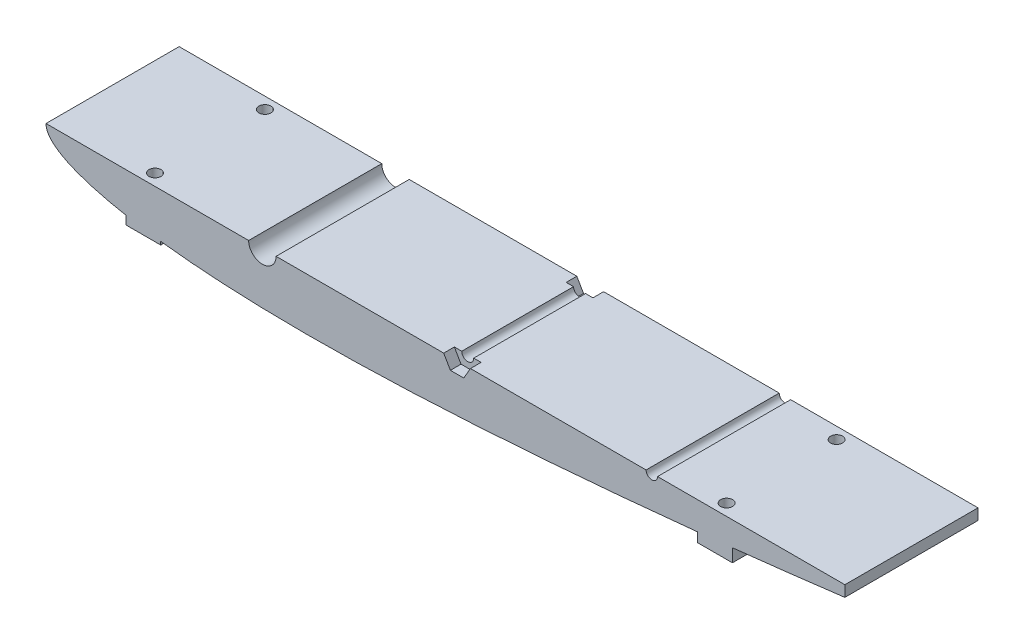
from build123d import *

# Parameters (mm, degrees)
BOSS_EXTRUDE1_DEPTH     = 50
SKETCH7_R               = 5.15
SKETCH7_R_2             = 2.15
SKETCH7_R_3             = 2.25
CUT_EXTRUDE7_DEPTH      = 332.074238212
CUT_EXTRUDE9_DEPTH      = 332.074238212
CUT_EXTRUDE9_DEPTH_BACK = 332.074238212
SKETCH14_W              = 25
SKETCH14_H              = 148.72296118
CUT_EXTRUDE10_DEPTH     = 4
SKETCH17_W              = 13.05
SKETCH17_H              = 10.44
BOSS_EXTRUDE3_DEPTH     = 18
SKETCH17_4_W            = 13.05
SKETCH17_4_H            = 8.7
BOSS_EXTRUDE4_DEPTH     = 14
SKETCH16_R              = 2.25
CUT_EXTRUDE11_DEPTH     = 305.770653444


with BuildPart() as part:
    # Sketch5 → Boss-Extrude1 (new body)
    with BuildSketch(Plane.XY):
        with BuildLine():
            Line((325, 0), (325, -0.8125))
            add(Edge.make_bspline(
                [(0, 0), (-0.000136334, -0.109947491), (0.011217022, -0.44380584), (0.091531115, -1.008739109), (0.28000866, -1.697350036), (0.570326629, -2.405952751), (0.972128321, -3.133069961), (1.501601232, -3.869655963), (2.167666579, -4.606780245), (2.974548458, -5.340894373), (3.92299008, -6.078607838), (5.026491776, -6.831942406), (6.323743507, -7.602711107), (7.86243332, -8.402334638), (9.696853946, -9.244289576), (11.887749699, -10.126064604), (14.491235181, -11.041005348), (17.554915415, -11.986787236), (21.111812688, -12.939833575), (25.154291463, -13.879004567), (29.628343363, -14.774017225), (34.451355428, -15.604977454), (39.538378585, -16.357696619), (44.822665134, -17.022400991), (50.253818421, -17.601755877), (55.79661226, -18.096948821), (61.424586454, -18.515680513), (67.118909774, -18.859097834), (72.866075339, -19.134782147), (78.657026682, -19.345218336), (84.485220535, -19.495583274), (90.346137868, -19.589596957), (96.236316011, -19.630365702), (102.15315587, -19.623040655), (108.093304522, -19.569199367), (114.052538822, -19.473028416), (120.026446486, -19.337631842), (126.012404478, -19.163679636), (132.010951859, -18.952971564), (138.023581313, -18.707272981), (144.050983869, -18.430030688), (150.090772329, -18.123377195), (156.13946647, -17.789004116), (162.194520528, -17.429048201), (168.255371118, -17.042717887), (174.322595274, -16.633294394), (180.396094786, -16.200549549), (186.475015116, -15.745953479), (192.558458018, -15.271563119), (198.645588678, -14.777223753), (204.735951015, -14.263489456), (210.82888863, -13.732306922), (216.923439137, -13.183318795), (223.019110705, -12.617530215), (229.116626208, -12.034995591), (235.21710855, -11.436453433), (241.31958931, -10.821771026), (247.420454668, -10.193582129), (253.516149602, -9.551964412), (259.607719504, -8.893526494), (265.699306561, -8.218086442), (271.790879479, -7.528200185), (277.876432063, -6.825294968), (283.950740403, -6.107941743), (290.009011969, -5.374398247), (296.033227296, -4.629952782), (301.977497958, -3.882428344), (307.751276839, -3.138180024), (313.203081724, -2.418806576), (318.130093691, -1.756964147), (322.003700809, -1.225331721), (324.209469269, -0.921419751), (325, -0.8125)],
                knots=[0.500000006, 0.500000006, 0.500000006, 0.500000006, 0.500497254, 0.501509846, 0.502575275, 0.503720952, 0.504968104, 0.506327181, 0.507817908, 0.509456832, 0.51125876, 0.513252884, 0.51550114, 0.518084934, 0.521098752, 0.524634237, 0.528771401, 0.533586692, 0.539144632, 0.545436374, 0.552369506, 0.5597952, 0.567587571, 0.575645113, 0.583901881, 0.592310372, 0.600833974, 0.609446995, 0.618132365, 0.626878386, 0.635677063, 0.644522588, 0.653411417, 0.66233984, 0.67130548, 0.680300932, 0.689318207, 0.698353715, 0.707408219, 0.716487807, 0.72559305, 0.734720584, 0.743862616, 0.753014776, 0.762177684, 0.771353253, 0.780541058, 0.789739607, 0.798946866, 0.808161911, 0.817384264, 0.826613351, 0.835846763, 0.845083505, 0.854324574, 0.863573405, 0.872830498, 0.882087801, 0.891335559, 0.900575658, 0.909822462, 0.919078681, 0.928326007, 0.93755243, 0.94676567, 0.95594962, 0.965029034, 0.973884889, 0.982301382, 0.989921047, 0.996387779, 1, 1, 1, 1], degree=3))
            Line((0, 0), (325, 0))
        make_face()
    extrude(amount=BOSS_EXTRUDE1_DEPTH)

    # Sketch7 → Cut-Extrude7 (cut, through all)
    with BuildSketch(Plane.XY.offset(60)):
        with Locations((81.25, 0)):
            Circle(SKETCH7_R)
        with Locations((227.5, 0)):
            Circle(SKETCH7_R_2)
        with Locations((154.375, 0)):
            Circle(SKETCH7_R_3)
    extrude(amount=-CUT_EXTRUDE7_DEPTH, mode=Mode.SUBTRACT)

    # Sketch14 → Cut-Extrude9 (cut, two sides: drawn at the far end of the back side and taken through both)
    with BuildSketch(Plane.XY.offset(60).offset(-CUT_EXTRUDE9_DEPTH_BACK)):
        with Locations((312.5, -4.34664034)):
            Rectangle(SKETCH14_W, SKETCH14_H)
    extrude(amount=CUT_EXTRUDE9_DEPTH + CUT_EXTRUDE9_DEPTH_BACK, mode=Mode.SUBTRACT)

    # Sketch15 → Cut-Extrude10 (cut)
    with BuildSketch(Plane.XY.offset(50)):
        Polygon((156.886473671, 4.35), (151.863526329, 4.35), (149.352052658, 0), (151.863526329, -4.35), (156.886473671, -4.35), (159.397947342, 0), align=None)
    cut_extrude10 = extrude(amount=-CUT_EXTRUDE10_DEPTH, mode=Mode.SUBTRACT)

    # Mirror1: Cut-Extrude10 across plane
    add(cut_extrude10.mirror(Plane.XY.offset(25)), mode=Mode.SUBTRACT)

    # Sketch17 → Boss-Extrude3 (add)
    with BuildSketch(Plane(origin=(0, 0, 0), x_dir=(1, 0, 0), z_dir=(0, 1, 0))):
        with Locations((36.5625, -5.22)):
            Rectangle(SKETCH17_W, SKETCH17_H)
        with Locations((36.5625, -44.78)):
            Rectangle(SKETCH17_W, SKETCH17_H)
    extrude(amount=-BOSS_EXTRUDE3_DEPTH)

    # Sketch17<4> → Boss-Extrude4 (add)
    with BuildSketch(Plane(origin=(0, 0, 0), x_dir=(1, 0, 0), z_dir=(0, 1, 0))):
        with Locations((251.25, -45.65)):
            Rectangle(SKETCH17_4_W, SKETCH17_4_H)
        with Locations((251.25, -4.35)):
            Rectangle(SKETCH17_4_W, SKETCH17_4_H)
    extrude(amount=-BOSS_EXTRUDE4_DEPTH)

    # Sketch16 → Cut-Extrude11 (cut, through all)
    with BuildSketch(Plane(origin=(0, 0, 0), x_dir=(1, 0, 0), z_dir=(0, 1, 0))):
        with Locations((36.5625, -4.35)):
            Circle(SKETCH16_R)
        with Locations((36.5625, -45.65)):
            Circle(SKETCH16_R)
        with Locations((251.25, -45.65)):
            Circle(SKETCH16_R)
        with Locations((251.25, -4.35)):
            Circle(SKETCH16_R)
    extrude(amount=-CUT_EXTRUDE11_DEPTH, mode=Mode.SUBTRACT)


solid = part.part
